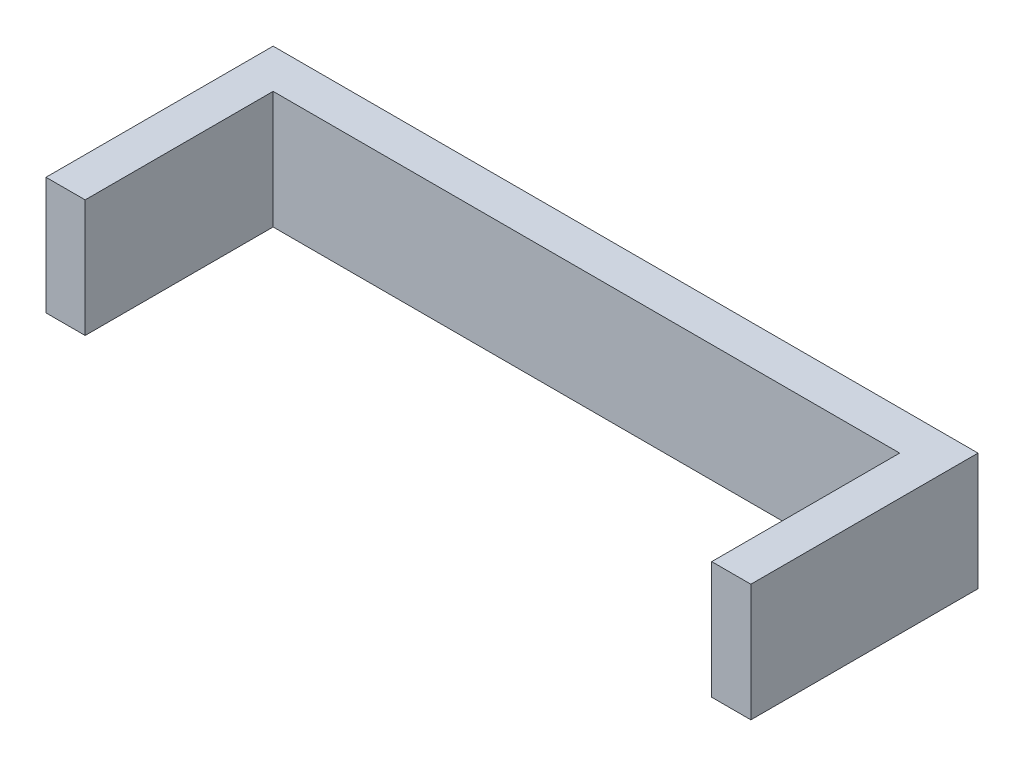
from build123d import *

# Parameters (mm, degrees)
BOSS_EXTRUDE1_DEPTH     = 10
SKETCH2_W               = 17.2
SKETCH2_H               = 43
CUT_EXTRUDE1_DEPTH      = 72.414284285
SKETCH3_W               = 90
SKETCH3_H               = 34
SKETCH3_W_2             = 80
SKETCH3_H_2             = 24
BOSS_EXTRUDE3_DEPTH     = 15
SKETCH4_W               = 49.6
SKETCH4_H               = 5
BOSS_EXTRUDE4_DEPTH     = 10
SKETCH5_W               = 15
SKETCH5_H               = 22
BOSS_EXTRUDE5_DEPTH     = 5
SKETCH6_W               = 90
SKETCH6_H               = 77
BOSS_EXTRUDE6_DEPTH     = 15
BOSS_EXTRUDE8_DEPTH     = 39
CHAMFER1_SIZE           = 64
CHAMFER1_SIZE_2         = 3.354097874
CHAMFER2_SIZE           = 64
CHAMFER2_SIZE_2         = 11.405813635
CHAMFER3_SIZE           = 64
CHAMFER3_SIZE_2         = 13.775745352
CUT_EXTRUDE3_DEPTH      = 95.500525601
CUT_EXTRUDE3_DEPTH_BACK = 95.500525601
SKETCH10_W              = 50
SKETCH10_H              = 27
SKETCH11_W              = 45.5
SKETCH11_H              = 10.5
CUT_EXTRUDE4_DEPTH      = 7.5
SKETCH14_W              = 2.05
SKETCH14_H              = 10.5
BOSS_EXTRUDE9_DEPTH     = 15
SKETCH15_R              = 8
CUT_EXTRUDE5_DEPTH      = 122.227059686
CUT_EXTRUDE6_DEPTH      = 2.5
CUT_EXTRUDE7_REACH      = 97.373
SKETCH18_W              = 29.6
SKETCH18_H              = 45
CUT_EXTRUDE8_DEPTH      = 15
SKETCH21_W              = 29.6
SKETCH21_H              = 15
BOSS_EXTRUDE10_DEPTH    = 2.5
SKETCH22_OUTSIDE_W      = 133.046
SKETCH22_OUTSIDE_H      = 133.046
SKETCH22_OUTSIDE_W_2    = 90
SKETCH22_OUTSIDE_H_2    = 72
CUT_EXTRUDE9_DEPTH      = 64
CUT_EXTRUDE10_DEPTH     = 10


with BuildPart() as part:
    # Sketch1 → Boss-Extrude1 (new body)
    with BuildSketch(Plane(origin=(0, 0, 0), x_dir=(1, 0, 0), z_dir=(0, 1, 0))):
        with BuildLine():
            Line((-35, 50), (35, 50))
            ThreePointArc((35, 50), (45.606601718, 45.606601718), (50, 35))
            Line((50, 35), (50, -35))
            ThreePointArc((50, -35), (45.606601718, -45.606601718), (35, -50))
            Line((35, -50), (-35, -50))
            ThreePointArc((-35, -50), (-45.606601718, -45.606601718), (-50, -35))
            Line((-50, -35), (-50, 35))
            ThreePointArc((-50, 35), (-45.606601718, 45.606601718), (-35, 50))
        make_face()
    extrude(amount=BOSS_EXTRUDE1_DEPTH)

    # Sketch2 → Cut-Extrude1 (cut, through all)
    with BuildSketch(Plane(origin=(0, 10, 0), x_dir=(1, 0, 0), z_dir=(0, 1, 0))):
        with Locations((-33.4, 18.5)):
            Rectangle(SKETCH2_W, SKETCH2_H)
        with Locations((33.4, 18.5)):
            Rectangle(SKETCH2_W, SKETCH2_H)
    extrude(amount=-CUT_EXTRUDE1_DEPTH, mode=Mode.SUBTRACT)

    # Sketch3 → Boss-Extrude3 (add)
    with BuildSketch(Plane(origin=(0, 10, 0), x_dir=(1, 0, 0), z_dir=(0, 1, 0))):
        with Locations((0, -20)):
            Rectangle(SKETCH3_W, SKETCH3_H)
        with Locations((0, -20)):
            Rectangle(SKETCH3_W_2, SKETCH3_H_2, mode=Mode.SUBTRACT)
    extrude(amount=BOSS_EXTRUDE3_DEPTH)

    # Sketch4 → Boss-Extrude4 (add)
    with BuildSketch(Plane(origin=(0, 10, 0), x_dir=(1, 0, 0), z_dir=(0, 1, 0))):
        with Locations((0, 10)):
            Rectangle(SKETCH4_W, SKETCH4_H)
        with Locations((0, 27)):
            Rectangle(SKETCH4_W, SKETCH4_H)
    extrude(amount=BOSS_EXTRUDE4_DEPTH)

    # Sketch5 → Boss-Extrude5 (add)
    with BuildSketch(Plane(origin=(0, 20, 0), x_dir=(1, 0, 0), z_dir=(0, 1, 0))):
        with Locations((-17.3, 18.5)):
            Rectangle(SKETCH5_W, SKETCH5_H)
        with Locations((17.3, 18.5)):
            Rectangle(SKETCH5_W, SKETCH5_H)
    extrude(amount=BOSS_EXTRUDE5_DEPTH)

    # Sketch6 → Boss-Extrude6 (add)
    with BuildSketch(Plane(origin=(0, 10, 0), x_dir=(1, 0, 0), z_dir=(0, 1, 0))):
        with BuildLine():
            Line((-50, 35), (-50, -35))
            ThreePointArc((-50, -35), (-45.606601718, -45.606601718), (-35, -50))
            Line((-35, -50), (35, -50))
            ThreePointArc((35, -50), (45.606601718, -45.606601718), (50, -35))
            Line((50, -35), (50, 35))
            ThreePointArc((50, 35), (45.606601718, 45.606601718), (35, 50))
            Line((35, 50), (-35, 50))
            ThreePointArc((-35, 50), (-45.606601718, 45.606601718), (-50, 35))
        make_face()
        with Locations((0, 1.5)):
            Rectangle(SKETCH6_W, SKETCH6_H, mode=Mode.SUBTRACT)
    extrude(amount=BOSS_EXTRUDE6_DEPTH)

    # Sketch9 → Boss-Extrude8 (add)
    with BuildSketch(Plane(origin=(0, 25, 0), x_dir=(1, 0, 0), z_dir=(0, 1, 0))):
        with BuildLine():
            Line((-50, 35), (-50, -35))
            ThreePointArc((-50, -35), (-45.606601718, -45.606601718), (-35, -50))
            Line((-35, -50), (35, -50))
            ThreePointArc((35, -50), (45.606601718, -45.606601718), (50, -35))
            Line((50, -35), (50, 35))
            ThreePointArc((50, 35), (45.606601718, 45.606601718), (35, 50))
            Line((35, 50), (-35, 50))
            ThreePointArc((-35, 50), (-45.606601718, 45.606601718), (-50, 35))
        make_face()
        with BuildLine():
            Line((-45, 35), (-45, -32))
            Line((-45, -32), (45, -32))
            Line((45, -32), (45, 35))
            ThreePointArc((45, 35), (44.659258263, 37.588190451), (43.660254038, 40))
            Line((43.660254038, 40), (-43.660254038, 40))
            ThreePointArc((-43.660254038, 40), (-44.659258263, 37.588190451), (-45, 35))
        make_face(mode=Mode.SUBTRACT)
    extrude(amount=BOSS_EXTRUDE8_DEPTH)

    # Chamfer1
    # the kernel refuses this chamfer: 64, 3.354097874 mm, written as the material it takes off along each edge
    with BuildSketch(Plane(origin=(-35, 64, 50), x_dir=(0, -0.9999979738662979, 0.002013023422382214), z_dir=(1, 0, 0)), Plane(origin=(50, 64, 35), x_dir=(0.002013023422382214, -0.9999979738662979, 0), z_dir=(0, 0, -1)), Plane(origin=(-50, 64, -35), x_dir=(-0.002013023422382214, -0.9999979738662979, 0), z_dir=(0, 0, 1)), Plane(origin=(35, 64, -50), x_dir=(0, -0.9999979738662979, -0.002013023422382214), z_dir=(-1, 0, 0))) as chamfer1_piece_1:
        Polygon((CHAMFER1_SIZE * 0.999997973866, CHAMFER1_SIZE * 0.00201302342238), (-CHAMFER1_SIZE_2 * 0.00201302342245, CHAMFER1_SIZE_2 * 0.9999979739), (0, 0), align=None)
    extrude(amount=70, mode=Mode.SUBTRACT)
    with BuildSketch(Plane(origin=(35, 64, 35), x_dir=(0, 0, 1), z_dir=(-1, 0, 0))) as chamfer1_piece_2:
        Polygon((15, -CHAMFER1_SIZE), (15 - CHAMFER1_SIZE_2, 0), (15, 0), align=None)
    revolve(axis=Axis((35, 64, 35), (0, 1, 0)), revolution_arc=90, mode=Mode.SUBTRACT)
    with BuildSketch(Plane(origin=(-35, 64, 35), x_dir=(-1, 0, 0), z_dir=(0, 0, -1))) as chamfer1_piece_3:
        Polygon((15, -CHAMFER1_SIZE), (15 - CHAMFER1_SIZE_2, 0), (15, 0), align=None)
    revolve(axis=Axis((-35, 64, 35), (0, 1, 0)), revolution_arc=90, mode=Mode.SUBTRACT)
    with BuildSketch(Plane(origin=(35, 64, -35), x_dir=(1, 0, 0), z_dir=(0, 0, 1))) as chamfer1_piece_4:
        Polygon((15, -CHAMFER1_SIZE), (15 - CHAMFER1_SIZE_2, 0), (15, 0), align=None)
    revolve(axis=Axis((35, 64, -35), (0, 1, 0)), revolution_arc=90, mode=Mode.SUBTRACT)
    with BuildSketch(Plane(origin=(-35, 64, -35), x_dir=(0, 0, -1), z_dir=(1, 0, 0))) as chamfer1_piece_5:
        Polygon((15 - CHAMFER1_SIZE_2, 0), (15, -CHAMFER1_SIZE), (15, 0), align=None)
    revolve(axis=Axis((-35, 64, -35), (0, 1, 0)), revolution_arc=90, mode=Mode.SUBTRACT)

    # Chamfer2
    # the kernel refuses this chamfer: 64, 11.405813635 mm, written as the material it takes off along each edge
    with BuildSketch(Plane(origin=(201.306482971, 64, -46.645902126), x_dir=(0, -0.9982575003065525, -0.05900816114499234), z_dir=(-1, 0, 0))) as chamfer2_piece_1:
        Polygon((CHAMFER2_SIZE * 0.999977671636, CHAMFER2_SIZE * 0.0066825316561), (-CHAMFER2_SIZE_2 * 0.0590081611462, CHAMFER2_SIZE_2 * 0.998257500326), (0, 0), align=None)
    extrude(amount=402.612965942, mode=Mode.SUBTRACT)

    # Chamfer3
    # the kernel refuses this chamfer: 64, 13.775745352 mm, written as the material it takes off along each edge
    with BuildSketch(Plane(origin=(-201.265469314, 64, 46.645902126), x_dir=(0, -0.9981787050157903, 0.06032638604292662), z_dir=(1, 0, 0))) as chamfer3_piece_1:
        Polygon((CHAMFER3_SIZE * 0.999967974892, CHAMFER3_SIZE * 0.00800307379952), (-CHAMFER3_SIZE_2 * 0.060326386045, CHAMFER3_SIZE_2 * 0.99817870505), (0, 0), align=None)
    extrude(amount=402.530938629, mode=Mode.SUBTRACT)

    # Sketch10 → Cut-Extrude3 (cut, two sides: drawn at the far end of the back side and taken through both)
    with BuildSketch(Plane(origin=(0, 1.307501734, 0), x_dir=(0, 0, 1), z_dir=(-1, 0, 0)).offset(-CUT_EXTRUDE3_DEPTH_BACK)):
        with Locations((-22.129843227, 49.192498266)):
            Rectangle(SKETCH10_W, SKETCH10_H)
    extrude(amount=CUT_EXTRUDE3_DEPTH + CUT_EXTRUDE3_DEPTH_BACK, mode=Mode.SUBTRACT)

    # Sketch11 → Cut-Extrude4 (cut)
    with BuildSketch(Plane(origin=(0, 10, 0), x_dir=(1, 0, 0), z_dir=(0, 1, 0))):
        with Locations((0, 34.75)):
            Rectangle(SKETCH11_W, SKETCH11_H)
    extrude(amount=-CUT_EXTRUDE4_DEPTH, mode=Mode.SUBTRACT)

    # Sketch14 → Boss-Extrude9 (add)
    with BuildSketch(Plane(origin=(0, 10, 0), x_dir=(1, 0, 0), z_dir=(0, 1, 0))):
        with Locations((-23.775, 34.75)):
            Rectangle(SKETCH14_W, SKETCH14_H)
        with Locations((23.775, 34.75)):
            Rectangle(SKETCH14_W, SKETCH14_H)
    extrude(amount=BOSS_EXTRUDE9_DEPTH)

    # Sketch15 → Cut-Extrude5 (cut, through all)
    with BuildSketch(Plane.XY.offset(-40)):
        with Locations((-12.75, 12.75)):
            Circle(SKETCH15_R)
        with Locations((12.75, 12.75)):
            Circle(SKETCH15_R)
    extrude(amount=-CUT_EXTRUDE5_DEPTH, mode=Mode.SUBTRACT)

    # Sketch17 → Cut-Extrude6 (cut)
    with BuildSketch(Plane(origin=(0, 0, -29.5), x_dir=(-1, 0, 0), z_dir=(0, 0, -1))):
        Polygon((-9.8, 25), (-22.75, 25), (-22.75, 2.5), (22.75, 2.5), (22.75, 25), (9.8, 25), (9.8, 20), (-9.8, 20), align=None)
    extrude(amount=-CUT_EXTRUDE6_DEPTH, mode=Mode.SUBTRACT)

    # Cut-Extrude7: up to this face of the body (flat: up to its plane)
    cut_extrude7_end = Plane(part.part.faces().sort_by_distance((0, 10, -18.5))[0])
    # Sketch18 → Cut-Extrude7 (cut, up to the picked face)
    with BuildSketch(Plane.XZ, mode=Mode.PRIVATE) as cut_extrude7_sk1:
        with Locations((0, -4.5)):
            Rectangle(SKETCH18_W, SKETCH18_H)
    cut_extrude7_tool1 = split(extrude(cut_extrude7_sk1.sketch, amount=-CUT_EXTRUDE7_REACH, mode=Mode.PRIVATE), bisect_by=cut_extrude7_end, keep=Keep.BOTH, mode=Mode.PRIVATE)
    add(cut_extrude7_tool1.solids().sort_by(Axis((0, 0, -4.5), (0, 1, 0)))[0], mode=Mode.SUBTRACT)

    # Sketch20 → Cut-Extrude8 (cut)
    with BuildSketch(Plane.XZ.offset(-25)):
        with BuildLine():
            Line((-45, -35), (-45, -40))
            Line((-45, -40), (-43.660254038, -40))
            ThreePointArc((-43.660254038, -40), (-44.659258263, -37.588190451), (-45, -35))
        make_face()
        with BuildLine():
            Line((45, -40), (45, -35))
            ThreePointArc((45, -35), (44.659258263, -37.588190451), (43.660254038, -40))
            Line((43.660254038, -40), (45, -40))
        make_face()
    extrude(amount=-CUT_EXTRUDE8_DEPTH, mode=Mode.SUBTRACT)

    # Sketch21 → Boss-Extrude10 (add)
    with BuildSketch(Plane.XZ):
        with Locations((0, -4.5)):
            Rectangle(SKETCH21_W, SKETCH21_H)
    extrude(amount=-BOSS_EXTRUDE10_DEPTH)

    # Sketch22 outside → Cut-Extrude9 (cut)
    with BuildSketch(Plane(origin=(0, 64, 0), x_dir=(1, 0, 0), z_dir=(0, 1, 0))):
        Rectangle(SKETCH22_OUTSIDE_W, SKETCH22_OUTSIDE_H)
        with Locations((0, 4)):
            Rectangle(SKETCH22_OUTSIDE_W_2, SKETCH22_OUTSIDE_H_2, mode=Mode.SUBTRACT)
    extrude(amount=-CUT_EXTRUDE9_DEPTH, mode=Mode.SUBTRACT)

    # Sketch23 → Cut-Extrude10 (cut)
    with BuildSketch(Plane.XZ):
        Polygon((-24.8, 3), (-24.8, -40), (24.8, -40), (24.8, 3), (42, 3), (42, -40), (45, -40), (45, 32), (-45, 32), (-45, -40), (-42, -40), (-42, 3), align=None)
    extrude(amount=-CUT_EXTRUDE10_DEPTH, mode=Mode.SUBTRACT)


with BuildPart() as cut_extrude10_piece_1:
    # of the separate pieces the step leaves, piece 1, a body of its own (cut_extrude10_pieces)
    add(part.part.solids().sort_by_distance((45, 10, 3))[0])


with BuildPart() as cut_extrude10_piece_2:
    # of the separate pieces the step leaves, piece 2, a body of its own (cut_extrude10_pieces)
    add(part.part.solids().sort_by_distance((24.8, 25, -7.5))[0])


solid = cut_extrude10_piece_1.part
